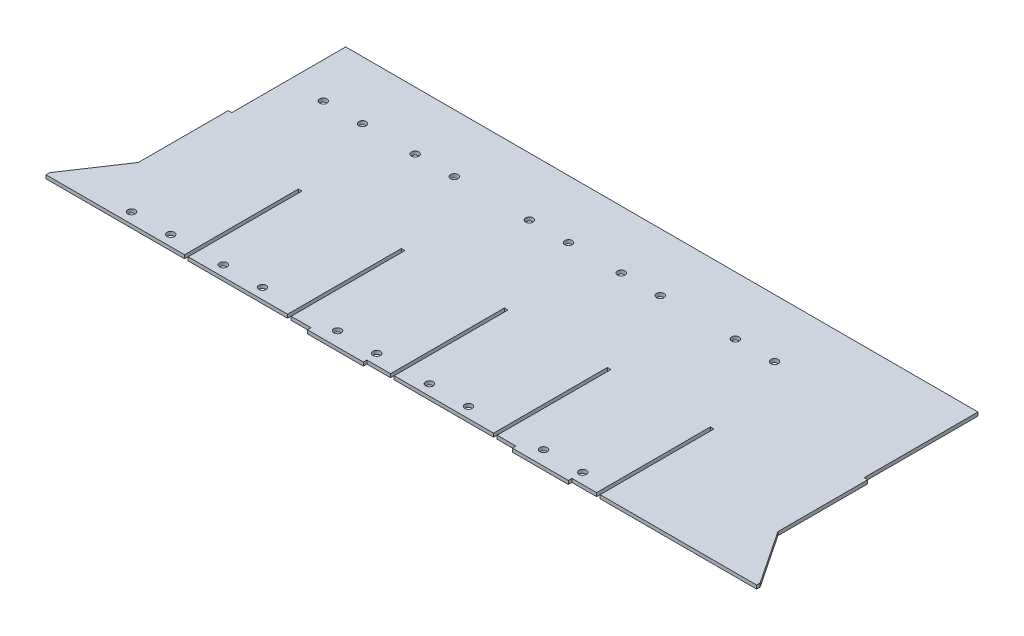
from build123d import *

# Parameters (mm, degrees)
SKETCH1_W            = 570.861
SKETCH1_H            = 3.175
BOSS_EXTRUDE1_DEPTH  = 232.6
SKETCH6_W            = 50
SKETCH6_H            = 3.175
BOSS_EXTRUDE2_DEPTH  = 3.175
SKETCH2_W            = 3.175
SKETCH2_H            = 101.6
CUT_EXTRUDE5_DEPTH   = 371.230335845
BOSS_EXTRUDE3_DEPTH  = 3.175
SKETCH13_W           = 3.175
SKETCH13_H           = 101.6
CUT_EXTRUDE6_DEPTH   = 396.22575932
LPATTERN2_COUNT      = 5
LPATTERN2_PITCH      = 91.9550104
M6_CLEARANCE_HOLE1_D = 6.6
M6_CLEARANCE_HOLE2_D = 6.6
LPATTERN3_COUNT      = 3
LPATTERN3_PITCH      = 183.919999952
LPATTERN4_COUNT      = 2
LPATTERN4_PITCH      = 183.919999952


with BuildPart() as part:
    # Sketch1 → Boss-Extrude1 (new body)
    with BuildSketch(Plane.XY):
        Rectangle(SKETCH1_W, SKETCH1_H)
    extrude(amount=BOSS_EXTRUDE1_DEPTH)

    # Sketch6 → Boss-Extrude2 (add)
    with BuildSketch(Plane.XY.offset(232.6)):
        with Locations((127.26300405, 0)):
            Rectangle(SKETCH6_W, SKETCH6_H)
        with Locations((-55.6950692, 0)):
            Rectangle(SKETCH6_W, SKETCH6_H)
    extrude(amount=BOSS_EXTRUDE2_DEPTH)

    # Sketch2 → Cut-Extrude5 (cut, through all)
    with BuildSketch(Plane(origin=(0, 1.5875, 0), x_dir=(1, 0, 0), z_dir=(0, 1, 0))):
        with Locations((283.843, -50.8)):
            Rectangle(SKETCH2_W, SKETCH2_H)
        with Locations((-283.843, -50.8)):
            Rectangle(SKETCH2_W, SKETCH2_H)
    extrude(amount=-CUT_EXTRUDE5_DEPTH, mode=Mode.SUBTRACT)

    # Sketch12 → Boss-Extrude3 (add)
    with BuildSketch(Plane(origin=(0, 1.5875, 0), x_dir=(1, 0, 0), z_dir=(0, 1, 0))):
        Polygon((-317.1805, -232.6), (-285.4305, -232.6), (-285.4305, -181.8), (-317.1805, -229.425), align=None)
    boss_extrude3 = extrude(amount=-BOSS_EXTRUDE3_DEPTH)

    # Mirror1: Boss-Extrude3 across plane
    add(boss_extrude3.mirror(Plane(origin=(0, 0, 0), x_dir=(0, 0, 1), z_dir=(1, 0, 0))))

    # Sketch13 → Cut-Extrude6 (cut, through all)
    with BuildSketch(Plane.XZ.offset(1.5875)):
        with Locations((-191.8879896, 181.8)):
            Rectangle(SKETCH13_W, SKETCH13_H)
    cut_extrude6 = extrude(amount=-CUT_EXTRUDE6_DEPTH, mode=Mode.SUBTRACT)

    # LPattern2: Cut-Extrude6 ×5
    with Locations(*[(i * LPATTERN2_PITCH, 0, 0) for i in range(1, LPATTERN2_COUNT)]):
        add(cut_extrude6, mode=Mode.SUBTRACT)

    # M6 Clearance Hole1 (through all)
    with Locations(Plane(origin=(0, 1.5875, 0), x_dir=(1, 0, 0), z_dir=(0, 1, 0))):
        with Locations((-250.327997081, -223.075), (-215.402997081, -223.075), (-215.402997081, -51.825), (-250.327997081, -51.825)):
            m6_clearance_hole1 = Hole(M6_CLEARANCE_HOLE1_D / 2)

    # M6 Clearance Hole2 (through all)
    with Locations(Plane(origin=(0, 1.5875, 0), x_dir=(1, 0, 0), z_dir=(0, 1, 0))):
        with Locations((-168.370494162, -223.075), (-133.445494162, -223.075), (-168.370494162, -51.825), (-133.445494162, -51.825)):
            m6_clearance_hole2 = Hole(M6_CLEARANCE_HOLE2_D / 2)

    # LPattern3: M6 Clearance Hole1 ×3
    with Locations(*[(i * LPATTERN3_PITCH, 0, 0) for i in range(1, LPATTERN3_COUNT)]):
        add(m6_clearance_hole1, mode=Mode.SUBTRACT)

    # LPattern4: M6 Clearance Hole2 ×2
    with Locations(*[(i * LPATTERN4_PITCH, 0, 0) for i in range(1, LPATTERN4_COUNT)]):
        add(m6_clearance_hole2, mode=Mode.SUBTRACT)


solid = part.part
